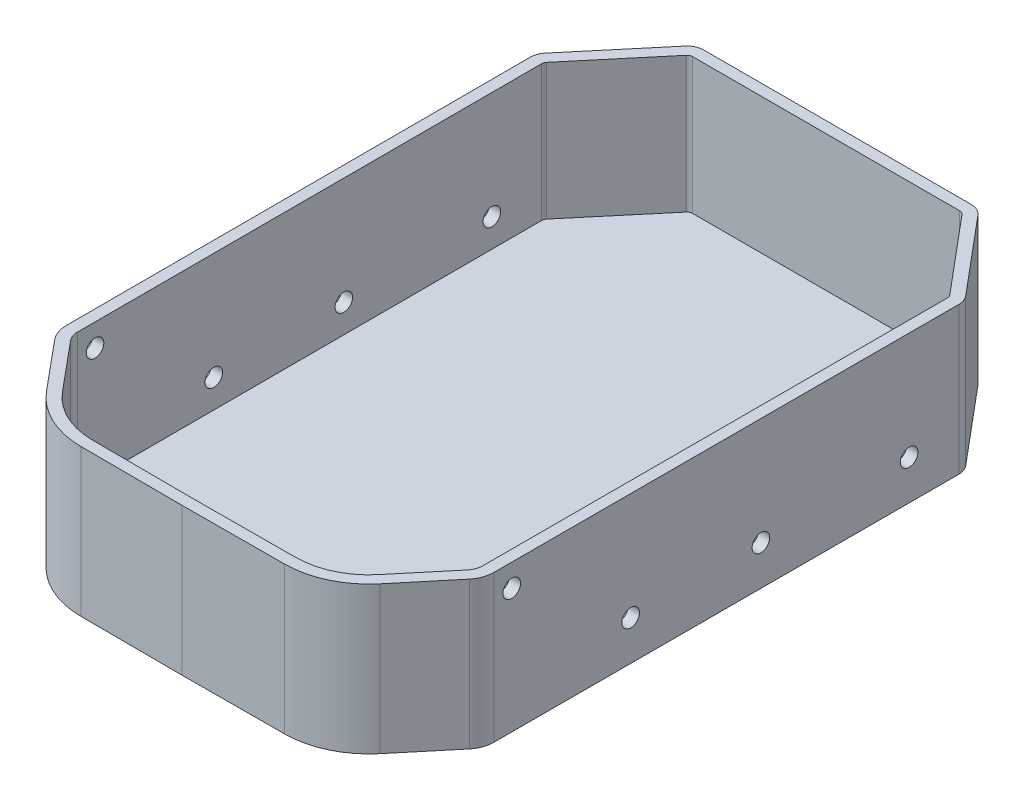
from build123d import *

# Parameters (mm, degrees)
AUFSATZ_LINEAR_AUSTRAGEN1_DEPTH = 26
VERRUNDUNG11_R                  = 15
VERRUNDUNG12_R                  = 5
VERRUNDUNG13_R                  = 3
VERRUNDUNG14_R                  = 3
WANDUNG4_T                      = -2
SCHNITT_LINEAR_AUSTRAGEN1_REACH = 112.174
SKIZZE7_R                       = 1.55


with BuildPart() as part:
    # Skizze1 → Aufsatz-Linear austragen1 (new body)
    with BuildSketch(Plane(origin=(0, 0, 0), x_dir=(1, 0, 0), z_dir=(0, 1, 0))):
        Polygon((0, -75.745036748), (-24.999786643, -75.641751751), (-37.792132404, -60.267881388), (-37.855752194, 24.732118612), (-25, 40.053007474), (0, 40.053007474), align=None)
    aufsatz_linear_austragen1 = extrude(amount=AUFSATZ_LINEAR_AUSTRAGEN1_DEPTH)

    # Spiegeln1: Aufsatz-Linear austragen1 across plane
    add(aufsatz_linear_austragen1.mirror(Plane(origin=(0, 0, 0), x_dir=(0, 0, 1), z_dir=(1, 0, 0))))

    # Verrundung11
    verrundung11_edges = [part.edges().sort_by_distance(p)[0] for p in [
        (-24.999786643, 13, 75.641751751),
        (24.999786643, 13, 75.641751751),
    ]]
    fillet(verrundung11_edges, radius=VERRUNDUNG11_R)

    # Verrundung12
    verrundung12_edges = [part.edges().sort_by_distance(p)[0] for p in [
        (37.792132404, 13, 60.267881388),
        (-37.792132404, 13, 60.267881388),
    ]]
    fillet(verrundung12_edges, radius=VERRUNDUNG12_R)

    # Verrundung13
    verrundung13_edges = [part.edges().sort_by_distance(p)[0] for p in [
        (-25, 13, -40.053007474),
        (25, 13, -40.053007474),
    ]]
    fillet(verrundung13_edges, radius=VERRUNDUNG13_R)

    # Verrundung14
    verrundung14_edges = [part.edges().sort_by_distance(p)[0] for p in [
        (37.855752194, 13, -24.732118612),
        (-37.855752194, 13, -24.732118612),
    ]]
    fillet(verrundung14_edges, radius=VERRUNDUNG14_R)

    # Wandung4
    wandung4_openings = [part.faces().sort_by_distance(p)[0] for p in [
        (0, 26, 17.703317915),
    ]]
    offset(amount=WANDUNG4_T, openings=wandung4_openings, kind=Kind.INTERSECTION)

    # Schnitt-Linear austragen1: up to this plane
    schnitt_linear_austragen1_end = Plane(origin=(37.792132404, 26, 60.267881388), z_dir=(0.9999997198978612, 0, 0.0007484679012413469))
    # Skizze7 → Schnitt-Linear austragen1 (cut, up to the surface)
    with BuildSketch(Plane(origin=(-37.837219795, 0, 0.028319952), x_dir=(0.0007484679012413468, 0, 0.9999997198978612), z_dir=(-0.9999997198978612, 0, 0.0007484679012413468)), mode=Mode.PRIVATE) as schnitt_linear_austragen1_sk1:
        with Locations((-14.847263192, 7)):
            Circle(SKIZZE7_R)
    schnitt_linear_austragen1_tool1 = split(extrude(schnitt_linear_austragen1_sk1.sketch, amount=-SCHNITT_LINEAR_AUSTRAGEN1_REACH, mode=Mode.PRIVATE), bisect_by=schnitt_linear_austragen1_end, keep=Keep.BOTH, mode=Mode.PRIVATE)
    add(schnitt_linear_austragen1_tool1.solids().sort_by_distance((-37.848332, 7, -14.818939))[0], mode=Mode.SUBTRACT)
    # Skizze7 → Schnitt-Linear austragen1 (cut, up to the surface)
    with BuildSketch(Plane(origin=(-37.837219795, 0, 0.028319952), x_dir=(0.0007484679012413468, 0, 0.9999997198978612), z_dir=(-0.9999997198978612, 0, 0.0007484679012413468)), mode=Mode.PRIVATE) as schnitt_linear_austragen1_sk2:
        with Locations((11.332736808, 7)):
            Circle(SKIZZE7_R)
    schnitt_linear_austragen1_tool2 = split(extrude(schnitt_linear_austragen1_sk2.sketch, amount=-SCHNITT_LINEAR_AUSTRAGEN1_REACH, mode=Mode.PRIVATE), bisect_by=schnitt_linear_austragen1_end, keep=Keep.BOTH, mode=Mode.PRIVATE)
    add(schnitt_linear_austragen1_tool2.solids().sort_by_distance((-37.828738, 7, 11.361054))[0], mode=Mode.SUBTRACT)
    # Skizze7 → Schnitt-Linear austragen1 (cut, up to the surface)
    with BuildSketch(Plane(origin=(-37.837219795, 0, 0.028319952), x_dir=(0.0007484679012413468, 0, 0.9999997198978612), z_dir=(-0.9999997198978612, 0, 0.0007484679012413468)), mode=Mode.PRIVATE) as schnitt_linear_austragen1_sk3:
        with Locations((34.332736808, 7)):
            Circle(SKIZZE7_R)
    schnitt_linear_austragen1_tool3 = split(extrude(schnitt_linear_austragen1_sk3.sketch, amount=-SCHNITT_LINEAR_AUSTRAGEN1_REACH, mode=Mode.PRIVATE), bisect_by=schnitt_linear_austragen1_end, keep=Keep.BOTH, mode=Mode.PRIVATE)
    add(schnitt_linear_austragen1_tool3.solids().sort_by_distance((-37.811523, 7, 34.361047))[0], mode=Mode.SUBTRACT)
    # Skizze7 → Schnitt-Linear austragen1 (cut, up to the surface)
    with BuildSketch(Plane(origin=(-37.837219795, 0, 0.028319952), x_dir=(0.0007484679012413468, 0, 0.9999997198978612), z_dir=(-0.9999997198978612, 0, 0.0007484679012413468)), mode=Mode.PRIVATE) as schnitt_linear_austragen1_sk4:
        with Locations((55.332736808, 22)):
            Circle(SKIZZE7_R)
    schnitt_linear_austragen1_tool4 = split(extrude(schnitt_linear_austragen1_sk4.sketch, amount=-SCHNITT_LINEAR_AUSTRAGEN1_REACH, mode=Mode.PRIVATE), bisect_by=schnitt_linear_austragen1_end, keep=Keep.BOTH, mode=Mode.PRIVATE)
    add(schnitt_linear_austragen1_tool4.solids().sort_by_distance((-37.795805, 22, 55.361041))[0], mode=Mode.SUBTRACT)


solid = part.part
